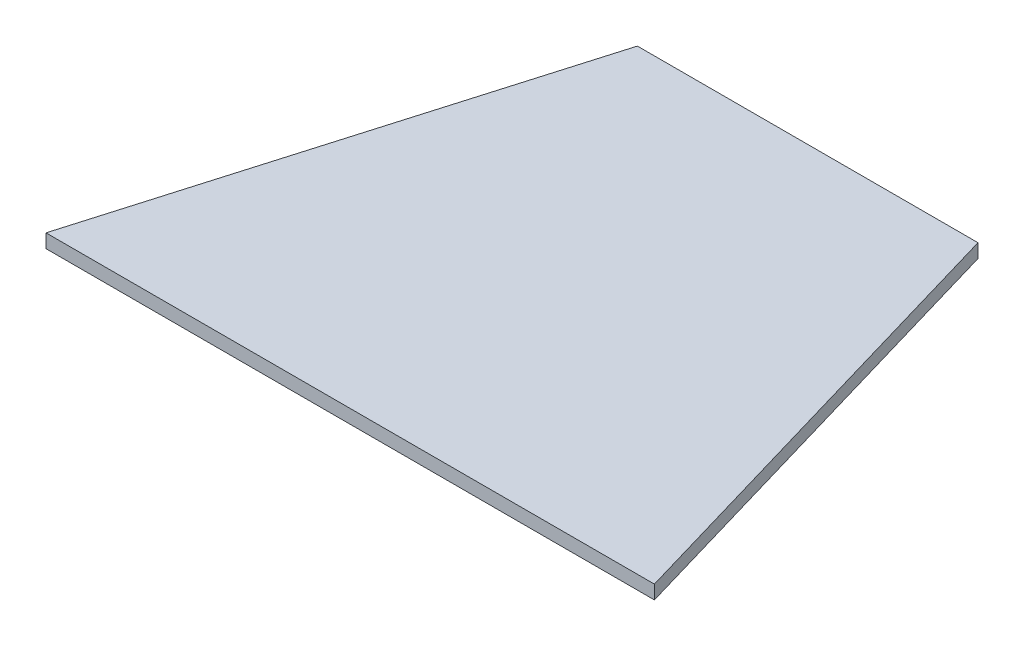
from build123d import *

# Parameters (mm, degrees)
BOSS_EXTRUDE1_DEPTH = 3


with BuildPart() as part:
    # Sketch1 → Boss-Extrude1 (new body)
    with BuildSketch(Plane(origin=(0, 0, 0), x_dir=(1, 0, 0), z_dir=(0, 1, 0))):
        Polygon((0, 0), (133, 0), (103.739006904, 100), (29.279941717, 100), align=None)
    extrude(amount=BOSS_EXTRUDE1_DEPTH)


solid = part.part
